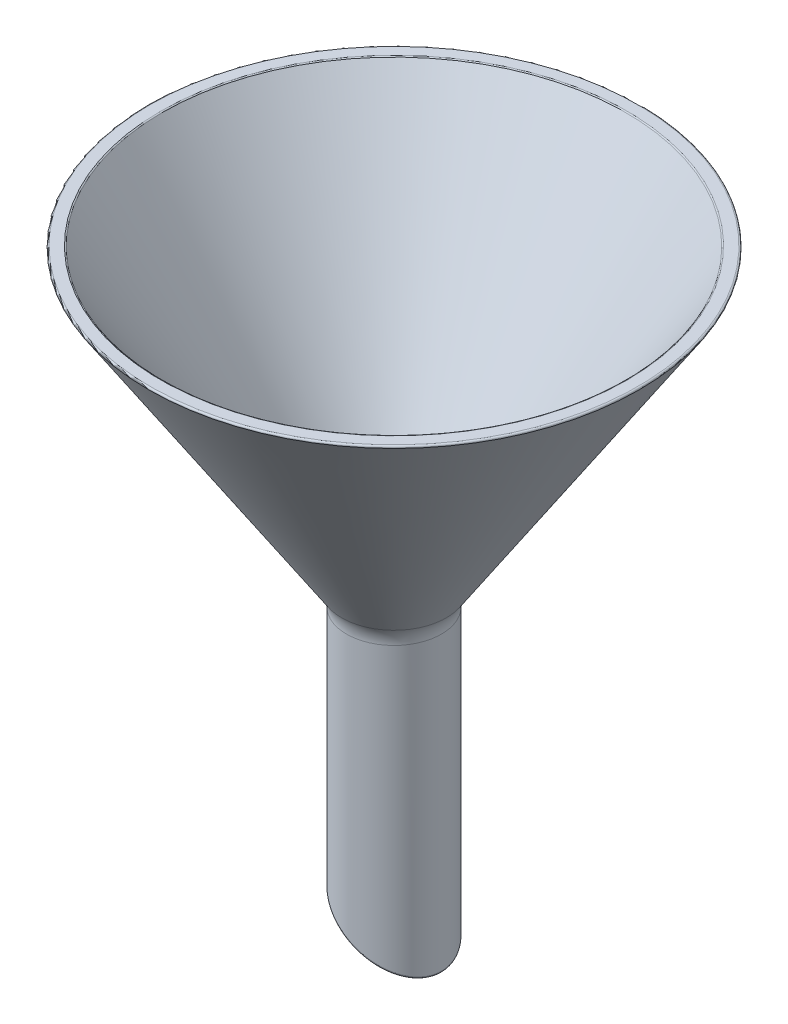
from build123d import *

# Parameters (mm, degrees)
SHELL1_T                = -1.016
CUT_EXTRUDE1_DEPTH      = 60.691688806
CUT_EXTRUDE1_DEPTH_BACK = 60.691688806
FILLET1_R               = 2.54
FILLET2_R               = 0.127


with BuildPart() as part:
    # Sketch1 → Revolve1 (revolve)
    with BuildSketch(Plane.XY):
        Polygon((0, 0), (0, -52.07), (-3.96875, -52.07), (-3.96875, -25.4), (-20.6375, 0), align=None)
    revolve(axis=Axis((0, 0, 0), (0, -1, 0)))

    # Shell1
    shell1_openings = [part.faces().sort_by_distance(p)[0] for p in [
        (0, 0, 0),
    ]]
    offset(amount=SHELL1_T, openings=shell1_openings, kind=Kind.INTERSECTION)

    # Sketch2 → Cut-Extrude1 (cut, two sides: drawn at the far end of the back side and taken through both)
    with BuildSketch(Plane.XY.offset(-CUT_EXTRUDE1_DEPTH_BACK)):
        Polygon((-3.96875, -45.72), (3.96875, -50.8), (3.96875, -52.07), (-3.96875, -52.07), align=None)
    extrude(amount=CUT_EXTRUDE1_DEPTH + CUT_EXTRUDE1_DEPTH_BACK, mode=Mode.SUBTRACT)

    # Fillet1
    fillet1_edges = [part.edges().sort_by_distance(p)[0] for p in [
        (2.95275, -25.096394118, 0),
        (3.96875, -25.4, 0),
    ]]
    fillet(fillet1_edges, radius=FILLET1_R)

    # Fillet2
    fillet2_edges = [part.edges().sort_by_distance(p)[0] for p in [
        (2.952749993, -50.149759995, -0.000204398),
        (1e-09, -48.260000001, -3.96875),
        (19.42225864, 0, 0),
        (20.6375, 0, 0),
    ]]
    fillet(fillet2_edges, radius=FILLET2_R)


solid = part.part
